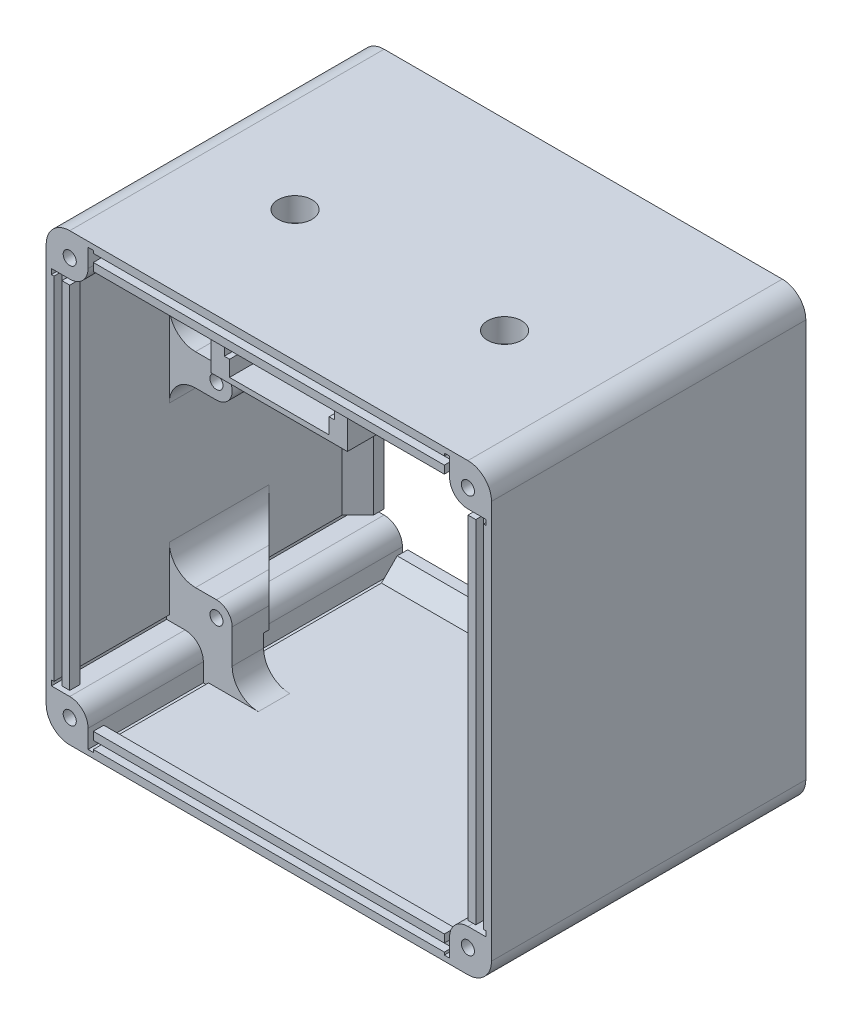
from build123d import *

# Parameters (mm, degrees)
SKETCH1_W               = 85
SKETCH1_H               = 85
BOSS_EXTRUDE1_DEPTH     = 60
CUT_EXTRUDE4_DEPTH      = 85.926438757
FILLET4_R               = 6
BOSS_EXTRUDE11_START    = 2
BOSS_EXTRUDE11_DEPTH    = 2
CUT_EXTRUDE_THIN2_DEPTH = 1.5
CHAMFER5_SIZE           = 3
BOSS_EXTRUDE6_START     = -60
BOSS_EXTRUDE6_DEPTH     = 60
SKETCH15_R              = 1.25
CUT_EXTRUDE7_DEPTH      = 85.926438757
CUT_EXTRUDE_THIN1_DEPTH = 85.926438757
MIRROR4_START           = -60
MIRROR4_COPY_1_DEPTH    = 60
MIRROR4_COPY_2_SKETCH_R = 1.25
MIRROR4_COPY_2_DEPTH    = 85.926438757
MIRROR4_COPY_3_DEPTH    = 85.926438757
BOSS_EXTRUDE8_START     = -32
BOSS_EXTRUDE8_DEPTH     = 6
SKETCH25_R              = 1.25
CUT_EXTRUDE10_DEPTH     = 5
CHAMFER1_START          = 30.735507692
CHAMFER1_DEPTH          = 1.264492308
CHAMFER1_START_2        = 19
CHAMFER1_2_DEPTH        = 11.735507692
CHAMFER1_START_3        = -33.5
CHAMFER1_3_DEPTH        = 46
FILLET5_R               = 5
CUT_EXTRUDE11_REACH     = 114.389
SKETCH29_R              = 3.25
SKETCH30_R              = 3.25
BOSS_EXTRUDE9_DEPTH     = 3
BOSS_EXTRUDE10_START    = -2
SKETCH31_W              = 26
SKETCH31_H              = 11
BOSS_EXTRUDE10_DEPTH    = 30
SKETCH32_W              = 19
SKETCH32_H              = 9.5
CUT_EXTRUDE12_DEPTH     = 26
SKETCH33_W              = 21
SKETCH33_H              = 1.5
CUT_EXTRUDE13_DEPTH     = 26
CHAMFER2_SIZE           = 3


with BuildPart() as part:
    # Sketch1 → Boss-Extrude1 (new body)
    with BuildSketch(Plane.XY):
        Rectangle(SKETCH1_W, SKETCH1_H)
    extrude(amount=BOSS_EXTRUDE1_DEPTH)

    # Sketch8 → Cut-Extrude4 (cut, through all)
    with BuildSketch(Plane(origin=(0, 0, 0), x_dir=(-1, 0, 0), z_dir=(0, 0, -1))):
        with BuildLine():
            Line((41, -36.5), (41, 36.5))
            ThreePointArc((41, 36.5), (39.681980515, 39.681980515), (36.5, 41))
            Line((36.5, 41), (-36.5, 41))
            ThreePointArc((-36.5, 41), (-39.681980515, 39.681980515), (-41, 36.5))
            Line((-41, 36.5), (-41, -36.5))
            ThreePointArc((-41, -36.5), (-39.681980515, -39.681980515), (-36.5, -41))
            Line((-36.5, -41), (36.5, -41))
            ThreePointArc((36.5, -41), (39.681980515, -39.681980515), (41, -36.5))
        make_face()
    extrude(amount=-CUT_EXTRUDE4_DEPTH, mode=Mode.SUBTRACT)

    # Fillet4
    fillet4_edges = [part.edges().sort_by_distance(p)[0] for p in [
        (42.5, -42.5, 30),
        (-42.5, -42.5, 30),
        (-42.5, 42.5, 30),
        (42.5, 42.5, 30),
    ]]
    fillet(fillet4_edges, radius=FILLET4_R)

    # Sketch34 → Boss-Extrude11 (add)
    with BuildSketch(Plane.XY.offset(BOSS_EXTRUDE11_START)):
        with BuildLine():
            Line((-36.5, -42.5), (36.5, -42.5))
            ThreePointArc((36.5, -42.5), (40.742640687, -40.742640687), (42.5, -36.5))
            Line((42.5, -36.5), (42.5, 36.5))
            ThreePointArc((42.5, 36.5), (40.742640687, 40.742640687), (36.5, 42.5))
            Line((36.5, 42.5), (-36.5, 42.5))
            ThreePointArc((-36.5, 42.5), (-40.742640687, 40.742640687), (-42.5, 36.5))
            Line((-42.5, 36.5), (-42.5, -36.5))
            ThreePointArc((-42.5, -36.5), (-40.742640687, -40.742640687), (-36.5, -42.5))
        make_face()
        with BuildLine():
            ThreePointArc((38, 36.5), (37.560660172, 37.560660172), (36.5, 38))
            Line((36.5, 38), (-36.5, 38))
            ThreePointArc((-36.5, 38), (-37.560660172, 37.560660172), (-38, 36.5))
            Line((-38, 36.5), (-38, -36.5))
            ThreePointArc((-38, -36.5), (-37.560660172, -37.560660172), (-36.5, -38))
            Line((-36.5, -38), (36.5, -38))
            ThreePointArc((36.5, -38), (37.560660172, -37.560660172), (38, -36.5))
            Line((38, -36.5), (38, 36.5))
        make_face(mode=Mode.SUBTRACT)
    boss_extrude11 = extrude(amount=-BOSS_EXTRUDE11_DEPTH)

    # Sketch35 → Cut-Extrude-Thin2 (cut)
    with BuildSketch(Plane(origin=(0, 0, 0), x_dir=(-1, 0, 0), z_dir=(0, 0, -1))):
        with BuildLine():
            Line((-41, 36.5), (-41, -36.5))
            ThreePointArc((-41, -36.5), (-39.681980515, -39.681980515), (-36.5, -41))
            Line((-36.5, -41), (36.5, -41))
            ThreePointArc((36.5, -41), (39.681980515, -39.681980515), (41, -36.5))
            Line((41, -36.5), (41, 36.5))
            ThreePointArc((41, 36.5), (39.681980515, 39.681980515), (36.5, 41))
            Line((36.5, 41), (-36.5, 41))
            ThreePointArc((-36.5, 41), (-39.681980515, 39.681980515), (-41, 36.5))
        make_face()
        with BuildLine():
            Line((-39.5, 36.5), (-39.5, -36.5))
            ThreePointArc((-39.5, -36.5), (-38.621320344, -38.621320344), (-36.5, -39.5))
            Line((-36.5, -39.5), (36.5, -39.5))
            ThreePointArc((36.5, -39.5), (38.621320344, -38.621320344), (39.5, -36.5))
            Line((39.5, -36.5), (39.5, 36.5))
            ThreePointArc((39.5, 36.5), (38.621320344, 38.621320344), (36.5, 39.5))
            Line((36.5, 39.5), (-36.5, 39.5))
            ThreePointArc((-36.5, 39.5), (-38.621320344, 38.621320344), (-39.5, 36.5))
        make_face(mode=Mode.SUBTRACT)
    cut_extrude_thin2 = extrude(amount=-CUT_EXTRUDE_THIN2_DEPTH, mode=Mode.SUBTRACT)

    # Mirror8: Boss-Extrude11, Cut-Extrude-Thin2 across plane
    add(boss_extrude11.mirror(Plane.XY.offset(30)))
    add(cut_extrude_thin2.mirror(Plane.XY.offset(30)), mode=Mode.SUBTRACT)

    # Chamfer5
    chamfer5_edges = [part.edges().sort_by_distance(p)[0] for p in [
        (0, -41, 58),
        (39.681980515, -39.681980515, 58),
        (41, 0, 58),
        (39.681980515, 39.681980515, 58),
        (0, 41, 58),
        (-39.681980515, 39.681980515, 58),
        (-41, 0, 58),
        (-39.681980515, -39.681980515, 58),
        (41, 0, 2),
        (39.681980515, -39.681980515, 2),
        (0, -41, 2),
        (-39.681980515, -39.681980515, 2),
        (-41, 0, 2),
        (-39.681980515, 39.681980515, 2),
        (0, 41, 2),
        (39.681980515, 39.681980515, 2),
    ]]
    chamfer(chamfer5_edges, length=CHAMFER5_SIZE - 0.0001)  # a hair under: the kernel refuses the full size

    # Sketch14 → Boss-Extrude6 (add)
    with BuildSketch(Plane.XY.offset(60).offset(BOSS_EXTRUDE6_START)):
        with BuildLine():
            Line((-38, 33.5), (-42.5, 33.5))
            Line((-42.5, 33.5), (-42.5, 38))
            ThreePointArc((-42.5, 38), (-41.181980515, 41.181980515), (-38, 42.5))
            Line((-38, 42.5), (-33.5, 42.5))
            Line((-33.5, 42.5), (-33.5, 38))
            ThreePointArc((-33.5, 38), (-34.818019485, 34.818019485), (-38, 33.5))
        make_face()
    boss_extrude6 = extrude(amount=BOSS_EXTRUDE6_DEPTH)

    # Sketch15 → Cut-Extrude7 (cut, through all)
    with BuildSketch(Plane(origin=(0, 0, 0), x_dir=(-1, 0, 0), z_dir=(0, 0, -1))):
        with Locations((38, 38)):
            Circle(SKETCH15_R)
    cut_extrude7 = extrude(amount=-CUT_EXTRUDE7_DEPTH, mode=Mode.SUBTRACT)

    # Sketch28 → Cut-Extrude-Thin1 (cut, through all)
    with BuildSketch(Plane(origin=(0, 0, 0), x_dir=(-1, 0, 0), z_dir=(0, 0, -1))):
        with BuildLine():
            Line((41.5, 33.5), (38, 33.5))
            ThreePointArc((38, 33.5), (34.818019485, 34.818019485), (33.5, 38))
            Line((33.5, 38), (33.5, 41.5))
            Line((33.5, 41.5), (34.5, 41.5))
            Line((34.5, 41.5), (34.5, 38))
            ThreePointArc((34.5, 38), (35.525126266, 35.525126266), (38, 34.5))
            Line((38, 34.5), (41.5, 34.5))
            Line((41.5, 34.5), (41.5, 33.5))
        make_face()
    cut_extrude_thin1 = extrude(amount=-CUT_EXTRUDE_THIN1_DEPTH, mode=Mode.SUBTRACT)

    # Mirror3: Boss-Extrude6, Cut-Extrude7, Cut-Extrude-Thin1 across plane
    add(boss_extrude6.mirror(Plane(origin=(0, 0, 0), x_dir=(0, 0, 1), z_dir=(1, 0, 0))))
    add(cut_extrude7.mirror(Plane(origin=(0, 0, 0), x_dir=(0, 0, 1), z_dir=(1, 0, 0))), mode=Mode.SUBTRACT)
    add(cut_extrude_thin1.mirror(Plane(origin=(0, 0, 0), x_dir=(0, 0, 1), z_dir=(1, 0, 0))), mode=Mode.SUBTRACT)

    # Mirror4: Boss-Extrude6, Cut-Extrude7, Cut-Extrude-Thin1 across plane
    add(boss_extrude6.mirror(Plane.ZX))
    add(cut_extrude7.mirror(Plane.ZX), mode=Mode.SUBTRACT)
    add(cut_extrude_thin1.mirror(Plane.ZX), mode=Mode.SUBTRACT)

    # Mirror4 copy 1 sketch → Mirror4 copy 1 (add)
    with BuildSketch(Plane(origin=(0, 0, 60), x_dir=(-1, 0, 0), z_dir=(0, 0, 1)).offset(MIRROR4_START)):
        with BuildLine():
            Line((-38, 33.5), (-42.5, 33.5))
            Line((-42.5, 33.5), (-42.5, 38))
            ThreePointArc((-42.5, 38), (-41.181980515, 41.181980515), (-38, 42.5))
            Line((-38, 42.5), (-33.5, 42.5))
            Line((-33.5, 42.5), (-33.5, 38))
            ThreePointArc((-33.5, 38), (-34.818019485, 34.818019485), (-38, 33.5))
        make_face()
    extrude(amount=MIRROR4_COPY_1_DEPTH)

    # Mirror4 copy 2 sketch → Mirror4 copy 2 (cut, through all)
    with BuildSketch(Plane(origin=(0, 0, 0), x_dir=(1, 0, 0), z_dir=(0, 0, -1))):
        with Locations((38, 38)):
            Circle(MIRROR4_COPY_2_SKETCH_R)
    extrude(amount=-MIRROR4_COPY_2_DEPTH, mode=Mode.SUBTRACT)

    # Mirror4 copy 3 sketch → Mirror4 copy 3 (cut, through all)
    with BuildSketch(Plane(origin=(0, 0, 0), x_dir=(1, 0, 0), z_dir=(0, 0, -1))):
        with BuildLine():
            Line((41.5, 33.5), (38, 33.5))
            ThreePointArc((38, 33.5), (34.818019485, 34.818019485), (33.5, 38))
            Line((33.5, 38), (33.5, 41.5))
            Line((33.5, 41.5), (34.5, 41.5))
            Line((34.5, 41.5), (34.5, 38))
            ThreePointArc((34.5, 38), (35.525126266, 35.525126266), (38, 34.5))
            Line((38, 34.5), (41.5, 34.5))
            Line((41.5, 34.5), (41.5, 33.5))
        make_face()
    extrude(amount=-MIRROR4_COPY_3_DEPTH, mode=Mode.SUBTRACT)

    # Sketch23 → Boss-Extrude8 (add)
    with BuildSketch(Plane(origin=(0, 0, 0), x_dir=(-1, 0, 0), z_dir=(0, 0, -1)).offset(BOSS_EXTRUDE8_START)):
        with BuildLine():
            Line((-38.5, -41.5), (-29, -41.5))
            Line((-29, -41.5), (-29, -29.5))
            ThreePointArc((-29, -29.5), (-29.878679656, -27.378679656), (-32, -26.5))
            Line((-32, -26.5), (-41.5, -26.5))
            Line((-41.5, -26.5), (-41.5, -38.5))
            ThreePointArc((-41.5, -38.5), (-40.621320344, -40.621320344), (-38.5, -41.5))
        make_face()
        with BuildLine():
            Line((-41.5, 12.5), (-32, 12.5))
            ThreePointArc((-32, 12.5), (-29, 9.5), (-32, 6.5))
            Line((-32, 6.5), (-41.5, 6.5))
            Line((-41.5, 6.5), (-41.5, 12.5))
        make_face()
    boss_extrude8 = extrude(amount=-BOSS_EXTRUDE8_DEPTH)

    # Sketch25 → Cut-Extrude10 (cut)
    with BuildSketch(Plane.XY.offset(38)):
        with Locations((32, -29.5)):
            Circle(SKETCH25_R)
        with Locations((32, 9.5)):
            Circle(SKETCH25_R)
    cut_extrude10 = extrude(amount=-CUT_EXTRUDE10_DEPTH, mode=Mode.SUBTRACT)

    # Mirror6: Boss-Extrude8, Cut-Extrude10 across plane
    add(boss_extrude8.mirror(Plane(origin=(0, 0, 0), x_dir=(0, 0, 1), z_dir=(1, 0, 0))))
    add(cut_extrude10.mirror(Plane(origin=(0, 0, 0), x_dir=(0, 0, 1), z_dir=(1, 0, 0))), mode=Mode.SUBTRACT)

    # Chamfer1: read off the stored shape, not the designer's step
    # Chamfer1 outline → Chamfer1 (add)
    with BuildSketch(Plane.XY.offset(CHAMFER1_START)):
        with BuildLine():
            Line((-41, 12.5), (-41, 6.5))
            Line((-41, 6.5), (-32, 6.5))
            ThreePointArc((-32, 6.5), (-29, 9.5), (-32, 12.5))
            Line((-32, 12.5), (-41, 12.5))
        make_face()
        with BuildLine():
            Line((-41, -33.5), (-29, -33.5))
            Line((-29, -33.5), (-29, -29.5))
            ThreePointArc((-29, -29.5), (-29.878679656, -27.378679656), (-32, -26.5))
            Line((-32, -26.5), (-41, -26.5))
            Line((-41, -26.5), (-41, -33.5))
        make_face()
        with BuildLine():
            Line((29, -29.5), (29, -33.5))
            Line((29, -33.5), (41, -33.5))
            Line((41, -33.5), (41, -26.5))
            Line((41, -26.5), (32, -26.5))
            ThreePointArc((32, -26.5), (29.878679656, -27.378679656), (29, -29.5))
        make_face()
        with BuildLine():
            Line((32, 6.5), (41, 6.5))
            Line((41, 6.5), (41, 12.5))
            Line((41, 12.5), (32, 12.5))
            ThreePointArc((32, 12.5), (29, 9.5), (32, 6.5))
        make_face()
    extrude(amount=CHAMFER1_DEPTH)

    # Chamfer1 2 outline → Chamfer1 2 (add)
    with BuildSketch(Plane.XY.offset(CHAMFER1_START_2)):
        with BuildLine():
            Line((-41, 12.5), (-41, 6.5))
            Line((-41, 6.5), (-32, 6.5))
            ThreePointArc((-32, 6.5), (-29, 9.5), (-32, 12.5))
            Line((-32, 12.5), (-41, 12.5))
        make_face()
        with BuildLine():
            Line((-41, -33.5), (-29, -33.5))
            Line((-29, -33.5), (-29, -29.5))
            ThreePointArc((-29, -29.5), (-29.878679656, -27.378679656), (-32, -26.5))
            Line((-32, -26.5), (-41, -26.5))
            Line((-41, -26.5), (-41, -33.5))
        make_face()
        with BuildLine():
            Line((29, -29.5), (29, -33.5))
            Line((29, -33.5), (41, -33.5))
            Line((41, -33.5), (41, -26.5))
            Line((41, -26.5), (32, -26.5))
            ThreePointArc((32, -26.5), (29.878679656, -27.378679656), (29, -29.5))
        make_face()
        with BuildLine():
            Line((32, 6.5), (41, 6.5))
            Line((41, 6.5), (41, 12.5))
            Line((41, 12.5), (32, 12.5))
            ThreePointArc((32, 12.5), (29, 9.5), (32, 6.5))
        make_face()
    extrude(amount=CHAMFER1_2_DEPTH)

    # Chamfer1 3 outline → Chamfer1 3 (cut)
    with BuildSketch(Plane(origin=(0, 0, 0), x_dir=(1, 0, 0), z_dir=(0, 1, 0)).offset(CHAMFER1_START_3)):
        Polygon((-41, -19), (-29, -31), (-29, -19), align=None)
        Polygon((29, -31), (41, -19), (29, -19), align=None)
    extrude(amount=CHAMFER1_3_DEPTH, mode=Mode.SUBTRACT)

    # Fillet5
    # the kernel refuses this fillet: 5 mm, written as the material it adds along each edge
    with BuildSketch(Plane(origin=(41, -26.5, 6.5), x_dir=(0, 1, 0), z_dir=(0, 0, 1))) as fillet5_piece_1_section:
        with BuildLine():
            CenterArc((FILLET5_R, FILLET5_R), FILLET5_R, 180, 90)
            Line((0, FILLET5_R), (0, 0))
            Line((0, 0), (FILLET5_R, 0))
        make_face()
    fillet5_piece_1 = extrude(amount=31.5, mode=Mode.PRIVATE)
    fillet5_piece_1 = split(fillet5_piece_1, bisect_by=Plane(origin=(47.25, -26.5, 12.75), z_dir=(0.7071067811865476, 0, 0.7071067811865476)), keep=Keep.TOP, mode=Mode.PRIVATE)
    add(fillet5_piece_1)
    with BuildSketch(Plane(origin=(29, -41, 38), x_dir=(-1, 0, 0), z_dir=(0, 0, -1)), Plane(origin=(-29, -41, 38), x_dir=(0, 1, 0), z_dir=(0, 0, -1))) as fillet5_piece_2:
        with BuildLine():
            CenterArc((FILLET5_R, FILLET5_R), FILLET5_R, 180, 90)
            Line((0, FILLET5_R), (0, 0))
            Line((0, 0), (FILLET5_R, 0))
        make_face()
    extrude(amount=6)
    with BuildSketch(Plane(origin=(41, 6.5, 38), x_dir=(0, -1, 0), z_dir=(0, 0, -1))) as fillet5_piece_3_section:
        with BuildLine():
            CenterArc((FILLET5_R, FILLET5_R), FILLET5_R, 180, 90)
            Line((0, FILLET5_R), (0, 0))
            Line((0, 0), (FILLET5_R, 0))
        make_face()
    fillet5_piece_3 = extrude(amount=31.5, mode=Mode.PRIVATE)
    fillet5_piece_3 = split(fillet5_piece_3, bisect_by=Plane(origin=(31.5, 6.5, 28.5), z_dir=(0.7071067811865476, 0, 0.7071067811865476)), keep=Keep.TOP, mode=Mode.PRIVATE)
    add(fillet5_piece_3)
    with BuildSketch(Plane(origin=(41, 12.5, 6.5), x_dir=(0, 1, 0), z_dir=(0, 0, 1))) as fillet5_piece_4_section:
        with BuildLine():
            CenterArc((FILLET5_R, FILLET5_R), FILLET5_R, 180, 90)
            Line((0, FILLET5_R), (0, 0))
            Line((0, 0), (FILLET5_R, 0))
        make_face()
    fillet5_piece_4 = extrude(amount=31.5, mode=Mode.PRIVATE)
    fillet5_piece_4 = split(fillet5_piece_4, bisect_by=Plane(origin=(47.25, 12.5, 12.75), z_dir=(0.7071067811865476, 0, 0.7071067811865476)), keep=Keep.TOP, mode=Mode.PRIVATE)
    add(fillet5_piece_4)
    with BuildSketch(Plane(origin=(-41, -26.5, 38), x_dir=(0, 1, 0), z_dir=(0, 0, -1))) as fillet5_piece_5_section:
        with BuildLine():
            CenterArc((FILLET5_R, FILLET5_R), FILLET5_R, 180, 90)
            Line((0, FILLET5_R), (0, 0))
            Line((0, 0), (FILLET5_R, 0))
        make_face()
    fillet5_piece_5 = extrude(amount=31.5, mode=Mode.PRIVATE)
    fillet5_piece_5 = split(fillet5_piece_5, bisect_by=Plane(origin=(-31.5, -26.5, 28.5), z_dir=(-0.7071067811865476, 0, 0.7071067811865476)), keep=Keep.TOP, mode=Mode.PRIVATE)
    add(fillet5_piece_5)
    with BuildSketch(Plane(origin=(-41, 12.5, 38), x_dir=(0, 1, 0), z_dir=(0, 0, -1))) as fillet5_piece_6_section:
        with BuildLine():
            CenterArc((FILLET5_R, FILLET5_R), FILLET5_R, 180, 90)
            Line((0, FILLET5_R), (0, 0))
            Line((0, 0), (FILLET5_R, 0))
        make_face()
    fillet5_piece_6 = extrude(amount=31.5, mode=Mode.PRIVATE)
    fillet5_piece_6 = split(fillet5_piece_6, bisect_by=Plane(origin=(-31.5, 12.5, 28.5), z_dir=(-0.7071067811865476, 0, 0.7071067811865476)), keep=Keep.TOP, mode=Mode.PRIVATE)
    add(fillet5_piece_6)
    with BuildSketch(Plane(origin=(-41, 6.5, 6.5), x_dir=(0, -1, 0), z_dir=(0, 0, 1))) as fillet5_piece_7_section:
        with BuildLine():
            CenterArc((FILLET5_R, FILLET5_R), FILLET5_R, 180, 90)
            Line((0, FILLET5_R), (0, 0))
            Line((0, 0), (FILLET5_R, 0))
        make_face()
    fillet5_piece_7 = extrude(amount=31.5, mode=Mode.PRIVATE)
    fillet5_piece_7 = split(fillet5_piece_7, bisect_by=Plane(origin=(-47.25, 6.5, 12.75), z_dir=(-0.7071067811865476, 0, 0.7071067811865476)), keep=Keep.TOP, mode=Mode.PRIVATE)
    add(fillet5_piece_7)

    # Sketch29 → Cut-Extrude11 (cut, up to next)
    with BuildSketch(Plane(origin=(0, 42.5, 0), x_dir=(1, 0, 0), z_dir=(0, 1, 0)), mode=Mode.PRIVATE) as cut_extrude11_sk1:
        with Locations(Location((-20, -35, 0), (0, 0, 270))):
            Circle(SKETCH29_R)
    cut_extrude11_tool1 = extrude(cut_extrude11_sk1.sketch, amount=-CUT_EXTRUDE11_REACH, mode=Mode.PRIVATE) & part.part
    # Sketch29 → Cut-Extrude11 (cut, up to next)
    with BuildSketch(Plane(origin=(0, 42.5, 0), x_dir=(1, 0, 0), z_dir=(0, 1, 0)), mode=Mode.PRIVATE) as cut_extrude11_sk2:
        with Locations(Location((20, -35, 0), (0, 0, 270))):
            Circle(SKETCH29_R)
    cut_extrude11_tool2 = extrude(cut_extrude11_sk2.sketch, amount=-CUT_EXTRUDE11_REACH, mode=Mode.PRIVATE) & part.part
    add(cut_extrude11_tool1.solids().sort_by_distance((-20, 42.5, 35))[0], mode=Mode.SUBTRACT)
    add(cut_extrude11_tool2.solids().sort_by_distance((20, 42.5, 35))[0], mode=Mode.SUBTRACT)

    # Sketch30 → Boss-Extrude9 (add)
    with BuildSketch(Plane.XZ.offset(-41)):
        with BuildLine():
            Line((-20, 28.5), (20, 28.5))
            ThreePointArc((20, 28.5), (26.5, 35), (20, 41.5))
            Line((20, 41.5), (-20, 41.5))
            ThreePointArc((-20, 41.5), (-26.5, 35), (-20, 28.5))
        make_face()
        with Locations(Location((-20, 35, 0), (0, 0, 90))):
            Circle(SKETCH30_R, mode=Mode.SUBTRACT)
        with Locations(Location((20, 35, 0), (0, 0, 90))):
            Circle(SKETCH30_R, mode=Mode.SUBTRACT)
    extrude(amount=BOSS_EXTRUDE9_DEPTH)

    # Sketch31 → Boss-Extrude10 (add)
    with BuildSketch(Plane.XY.offset(60).offset(BOSS_EXTRUDE10_START)):
        with Locations((0, 36)):
            Rectangle(SKETCH31_W, SKETCH31_H)
    extrude(amount=-BOSS_EXTRUDE10_DEPTH)

    # Sketch32 → Cut-Extrude12 (cut)
    with BuildSketch(Plane.XY.offset(58)):
        with Locations((0, 36.25)):
            Rectangle(SKETCH32_W, SKETCH32_H)
    extrude(amount=-CUT_EXTRUDE12_DEPTH, mode=Mode.SUBTRACT)

    # Sketch33 → Cut-Extrude13 (cut)
    with BuildSketch(Plane.XY.offset(58)):
        with Locations((0, 35.25)):
            Rectangle(SKETCH33_W, SKETCH33_H)
    extrude(amount=-CUT_EXTRUDE13_DEPTH, mode=Mode.SUBTRACT)

    # Chamfer3
    # the kernel refuses this chamfer: 11 mm, written as the material it adds along each edge
    with BuildSketch(Plane(origin=(13, 41, 28), x_dir=(0, 0, -1), z_dir=(-1, 0, 0))) as chamfer3_piece_1_section:
        with BuildLine():
            Line((11.311126984, -0.311126984), (-0.311126984, 11.311126984))
            Line((-0.311126984, 11.311126984), (-0.531126984, 11.311126984))
            ThreePointArc((-0.531126984, 11.311126984), (-0.22, 5.655563492), (-0.22, 0))
            Line((-0.22, 0), (0, -0.22))
            ThreePointArc((0, -0.22), (5.655563492, -0.22), (11.311126984, -0.531126984))
            Line((11.311126984, -0.531126984), (11.311126984, -0.311126984))
        make_face()
    chamfer3_piece_1 = extrude(amount=26, mode=Mode.PRIVATE)
    chamfer3_piece_1 = split(chamfer3_piece_1, bisect_by=Plane(origin=(13, 30.5, 28), z_dir=(0, 1, 0)), keep=Keep.TOP, mode=Mode.PRIVATE)
    add(chamfer3_piece_1)

    # Chamfer2
    chamfer2_edges = [part.edges().sort_by_distance(p)[0] for p in [
        (26.5, 41, 35),
        (-26.5, 41, 35),
        (-16.5, 41, 41.5),
        (16.5, 41, 41.5),
        (-16.5, 41, 28.5),
        (16.5, 41, 28.5),
        (-13, 41, 48.25005),
        (-13, 41, 22.75),
        (13, 41, 22.75),
        (13, 41, 48.25005),
    ]]
    chamfer(chamfer2_edges, length=CHAMFER2_SIZE - 0.0001)  # a hair under: the kernel refuses the full size


solid = part.part
